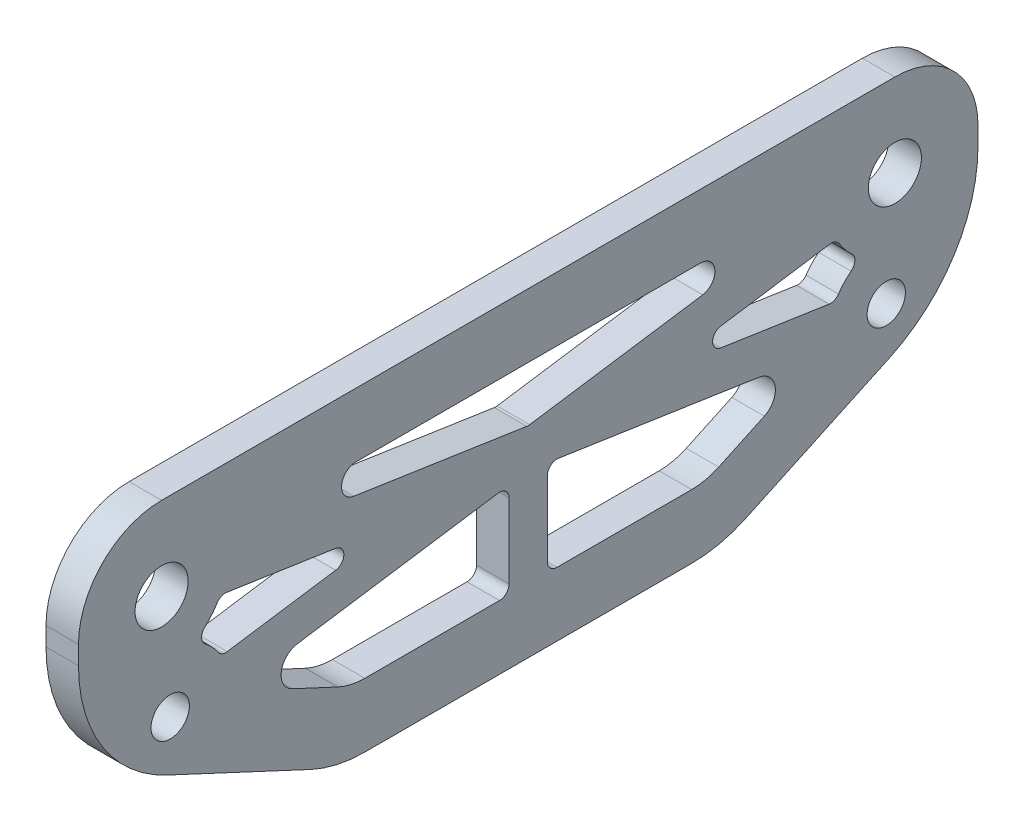
from build123d import *

# Parameters (mm, degrees)
SKETCH1_R           = 2.075
SKETCH1_R_2         = 1.5
BOSS_EXTRUDE1_DEPTH = 2.54
FILLET1_R           = 10
CUT_EXTRUDE2_DEPTH  = 38.416336339
FILLET2_R           = 0.75


with BuildPart() as part:
    # Sketch1 → Boss-Extrude1 (new body)
    with BuildSketch(Plane(origin=(0, 0, 0), x_dir=(0, 0, -1), z_dir=(1, 0, 0))):
        with BuildLine():
            Line((15, 12.5), (28.675, 12.5))
            ThreePointArc((28.675, 12.5), (33.271194078, 10.596194078), (35.175, 6))
            Line((35.175, 6), (35.175, 4.552600133))
            ThreePointArc((35.175, 4.552600133), (33.29569735, -1.894995167), (28.246419141, -6.323093311))
            Line((28.246419141, -6.323093311), (15, -12.5))
            Line((15, -12.5), (-15, -12.5))
            Line((-15, -12.5), (-28.246419141, -6.323093311))
            ThreePointArc((-28.246419141, -6.323093311), (-33.29569735, -1.894995167), (-35.175, 4.552600133))
            Line((-35.175, 4.552600133), (-35.175, 6))
            ThreePointArc((-35.175, 6), (-33.271194078, 10.596194078), (-28.675, 12.5))
            Line((-28.675, 12.5), (-15, 12.5))
            Line((-15, 12.5), (15, 12.5))
        make_face()
        with Locations((28.675, 6)):
            Circle(SKETCH1_R, mode=Mode.SUBTRACT)
        with Locations((-28.675, 6)):
            Circle(SKETCH1_R, mode=Mode.SUBTRACT)
        with Locations((28, -2.5)):
            Circle(SKETCH1_R_2, mode=Mode.SUBTRACT)
        with Locations((-28, -2.5)):
            Circle(SKETCH1_R_2, mode=Mode.SUBTRACT)
    extrude(amount=BOSS_EXTRUDE1_DEPTH)

    # Fillet1
    fillet1_edges = [part.edges().sort_by_distance(p)[0] for p in [
        (1.27, -12.5, -15),
        (1.27, -12.5, 15),
    ]]
    fillet(fillet1_edges, radius=FILLET1_R)

    # Sketch2 → Cut-Extrude2 (cut, through all)
    with BuildSketch(Plane(origin=(0, 0, 0), x_dir=(0, 0, -1), z_dir=(1, 0, 0))):
        with BuildLine():
            ThreePointArc((-26.145705208, 1.600193998), (-24.921430671, 0.782135111), (-24.0267635, -0.387325933))
            Line((-24.0267635, -0.387325933), (-10.113328529, 1.699382444))
            Line((-10.113328529, 1.699382444), (-24.10284261, 3.797501009))
            ThreePointArc((-24.10284261, 3.797501009), (-24.958187481, 2.544434966), (-26.145705208, 1.600193998))
        make_face()
        with BuildLine():
            ThreePointArc((-18.05266707, -2.524895679), (-19.314720885, -3.793448624), (-18.464115781, -5.367766688))
            Line((-18.464115781, -5.367766688), (-14.896144682, -7.031538935))
            ThreePointArc((-14.896144682, -7.031538935), (-13.865251443, -7.381480036), (-12.783053374, -7.5))
            Line((-12.783053374, -7.5), (-1.5, -7.5))
            Line((-1.5, -7.5), (-1.5, -0.042360697))
            Line((-1.5, -0.042360697), (-18.05266707, -2.524895679))
        make_face()
        with BuildLine():
            Line((13.477042722, 7.5), (-13.477042722, 7.5))
            ThreePointArc((-13.477042722, 7.5), (-14.598927658, 6.458661159), (-13.643901733, 5.262443004))
            Line((-13.643901733, 5.262443004), (0, 3.216158668))
            Line((0, 3.216158668), (13.643901733, 5.262443004))
            ThreePointArc((13.643901733, 5.262443004), (14.598927658, 6.458661159), (13.477042722, 7.5))
        make_face()
        with BuildLine():
            Line((18.05266707, -2.524895679), (1.5, -0.042360697))
            Line((1.5, -0.042360697), (1.5, -7.5))
            Line((1.5, -7.5), (12.783053374, -7.5))
            ThreePointArc((12.783053374, -7.5), (13.865251443, -7.381480036), (14.896144682, -7.031538935))
            Line((14.896144682, -7.031538935), (18.464115781, -5.367766688))
            ThreePointArc((18.464115781, -5.367766688), (19.314720885, -3.793448624), (18.05266707, -2.524895679))
        make_face()
        with BuildLine():
            Line((24.10284261, 3.797501009), (10.113328529, 1.699382444))
            Line((10.113328529, 1.699382444), (24.0267635, -0.387325933))
            ThreePointArc((24.0267635, -0.387325933), (24.921430671, 0.782135111), (26.145705208, 1.600193998))
            ThreePointArc((26.145705208, 1.600193998), (24.958187481, 2.544434966), (24.10284261, 3.797501009))
        make_face()
    extrude(amount=CUT_EXTRUDE2_DEPTH, mode=Mode.SUBTRACT)

    # Fillet2
    fillet2_edges = [part.edges().sort_by_distance(p)[0] for p in [
        (1.27, -7.5, -1.5),
        (1.27, 3.797501009, -24.10284261),
        (1.27, 1.699382444, -10.113328529),
        (1.27, 3.797501009, 24.10284261),
        (1.27, 3.216158668, 0),
        (1.27, -0.042360697, -1.5),
        (1.27, -7.5, 1.5),
        (1.27, -0.042360697, 1.5),
        (1.27, 1.699382444, 10.113328529),
        (1.27, -0.387325933, -24.0267635),
        (1.27, 1.600193998, -26.145705208),
        (1.27, -0.387325933, 24.0267635),
        (1.27, 1.600193998, 26.145705208),
    ]]
    fillet(fillet2_edges, radius=FILLET2_R)


solid = part.part
